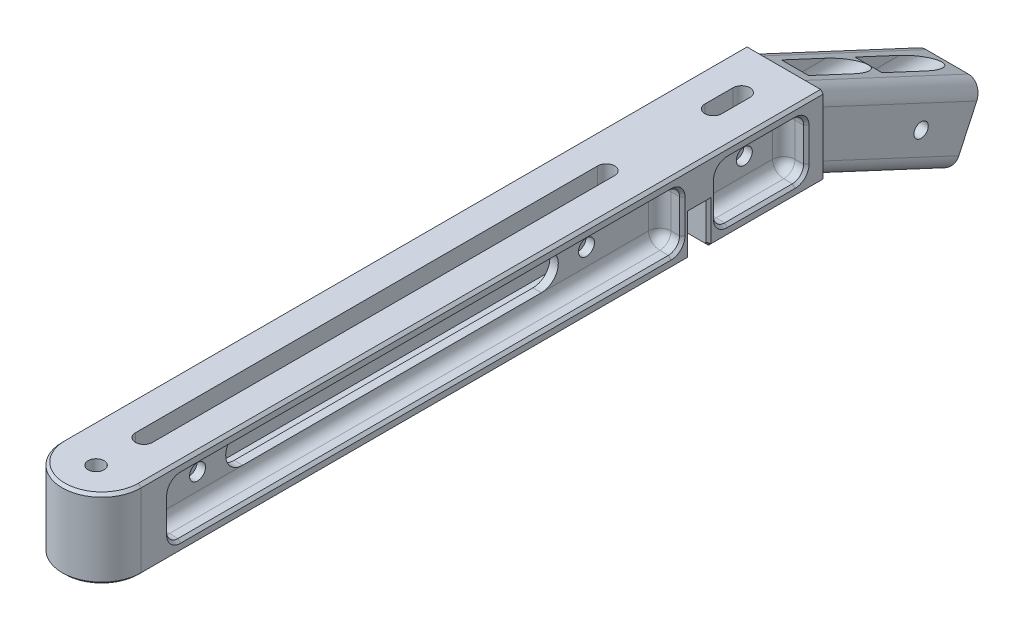
from build123d import *

# Parameters (mm, degrees)
BOSS_EXTRUDE1_DEPTH             = 203.2
CUT_EXTRUDE1_DEPTH              = 9.525
F_8_CLEARANCE_HOLE1_D           = 4.4958
BOSS_EXTRUDE2_START             = -1.0794999999999995
BOSS_EXTRUDE2_DEPTH             = 20.066
FILLET3_RADIUS                  = 11.1125
FILLET3_LENGTH                  = 22.225
CUT_EXTRUDE2_START              = 184.15
SKETCH19_W                      = 6.3500000000000005
SKETCH19_H                      = 15.874999999999996
CUT_EXTRUDE2_DEPTH              = 179.3875
SKETCH23_R                      = 3.968750000000001
BOSS_EXTRUDE5_DEPTH             = 22.225
FILLET4_R                       = 3.175
F_8_32_TAPPED_HOLE1_AT_2_COUNT  = 2
F_8_32_TAPPED_HOLE1_AT_2_PITCH  = 9.644311542843937
SKETCH28_W                      = 4.7625
SKETCH28_H                      = 12.699999999999983
SKETCH28_W_2                    = 4.762500000000001
SKETCH28_H_2                    = 134.9375
CUT_EXTRUDE3_DEPTH              = 19.05
F_8_CLEARANCE_HOLE2_AT_2_COUNT  = 2
F_8_CLEARANCE_HOLE2_AT_2_PITCH  = 44.44999999999999
F_8_CLEARANCE_HOLE2_AT_3_COUNT  = 2
F_8_CLEARANCE_HOLE2_AT_3_PITCH  = 153.9875
FILLET5_R                       = 2.38125
FILLET6_R                       = 2.38125
FILLET7_R                       = 2.38125
FILLET8_R                       = 2.38125
BOSS_EXTRUDE6_DEPTH             = 4.7625
SKETCH34_R                      = 15.081250000000074
CUT_EXTRUDE4_DEPTH              = 2.6035
CUT_EXTRUDE5_DEPTH              = 7.619999999999999
F_10_32_TAPPED_HOLE2_AT_2_COUNT = 2
F_10_32_TAPPED_HOLE2_AT_2_PITCH = 17.907000000000004
FILLET10_START                  = -11.1125
FILLET10_DEPTH                  = 5.0165001
FILLET12_R                      = 4.064
CUT_EXTRUDE8_DEPTH              = 209.63557086842175
CUT_EXTRUDE9_DEPTH              = 230.11389098368053
FILLET14_R                      = 3.175
CHAMFER2_SIZE                   = 0.762
FILLET15_R                      = 1.5875
CUT_EXTRUDE10_DEPTH             = 207.39492188468986
CHAMFER3_SIZE                   = 0.762
CHAMFER4_SIZE                   = 0.762
CUT_EXTRUDE11_DEPTH             = 206.80799007452856


with BuildPart() as part:
    # Sketch1 → Boss-Extrude1 (new body)
    with BuildSketch(Plane.XY):
        Polygon((-11.112499999999997, 11.112499999999997), (11.112500000000002, 11.112499999999997), (11.112500000000004, -11.1125), (-11.112499999999994, -11.1125), align=None)
    extrude(amount=BOSS_EXTRUDE1_DEPTH)

    # Sketch2 → Cut-Extrude1 (cut)
    with BuildSketch(Plane.XZ.offset(11.1125)):
        with BuildLine():
            Line((-0.7937500000000002, 200.02499999999998), (0.7937500000000002, 200.02499999999998))
            ThreePointArc((0.7937500000000002, 200.02499999999998), (3.0388140302672886, 199.09506403026725), (3.96875, 196.84999999999997))
            Line((3.96875, 196.84999999999997), (3.96875, 190.49999999999997))
            ThreePointArc((3.96875, 190.49999999999997), (3.0388140302672966, 188.25493596973268), (0.7937500000000002, 187.32499999999996))
            Line((0.7937500000000002, 187.32499999999996), (-0.7937500000000002, 187.32499999999996))
            ThreePointArc((-0.7937500000000002, 187.32499999999996), (-3.038814030267288, 188.25493596973268), (-3.968749999999999, 190.49999999999997))
            Line((-3.968749999999999, 190.49999999999997), (-3.96875, 196.84999999999997))
            ThreePointArc((-3.96875, 196.84999999999997), (-3.0388140302672966, 199.09506403026725), (-0.7937500000000002, 200.02499999999998))
        make_face()
    extrude(amount=-CUT_EXTRUDE1_DEPTH, mode=Mode.SUBTRACT)

    # #8 Clearance Hole1 (through all)
    with Locations(Plane(origin=(0, -1.5875000000000004, 0), x_dir=(-1, 0, 0), z_dir=(0, -1, 0))):
        with Locations((0, -193.675)):
            Hole(F_8_CLEARANCE_HOLE1_D / 2)

    # Fillet3: full round fillet: the end face becomes a half cylinder, R = half its width
    fillet3_face = Plane((0, 0, 203.2), x_dir=(0, -1, 0), z_dir=(0, 0, 1))  # on the end face: x along it, z out of the body
    fillet3_slab = fillet3_face.offset(-FILLET3_RADIUS / 2) * Box(FILLET3_LENGTH, 2 * FILLET3_RADIUS, FILLET3_RADIUS, mode=Mode.PRIVATE)  # the body's end, R deep
    fillet3_round = Plane((0, 0, 192.08749999999998), x_dir=(0, 0, 1), z_dir=(0, -1, 0)) * Cylinder(FILLET3_RADIUS, FILLET3_LENGTH, mode=Mode.PRIVATE)  # its axis R under the face
    add(fillet3_slab - fillet3_round, mode=Mode.SUBTRACT)

    # Sketch19 → Cut-Extrude2 (cut)
    with BuildSketch(Plane.XY.offset(CUT_EXTRUDE2_START)):
        with Locations((7.9375000000000036, -2.22e-15)):
            Rectangle(SKETCH19_W, SKETCH19_H)
        Polygon((-4.762499999999997, -7.937500000000002), (-11.112499999999997, -7.9375), (-11.112499999999997, 7.9374999999999964), (-4.762499999999997, 7.9374999999999964), align=None)
    extrude(amount=-CUT_EXTRUDE2_DEPTH, mode=Mode.SUBTRACT)

    # Sketch23 → Boss-Extrude5 (add)
    with BuildSketch(Plane.XZ.offset(11.1125)):
        with Locations((0, 34.92499999999998)):
            Circle(SKETCH23_R)
    extrude(amount=-BOSS_EXTRUDE5_DEPTH)

    # Fillet4
    fillet4_edges = [part.edges().sort_by_distance(p)[0] for p in [
        (4.762500000000004, -7.9375, 94.45625000000001),
        (4.762500000000004, 7.9374999999999964, 94.45625000000001),
        (7.9375000000000036, 7.9374999999999964, 184.15),
        (4.762500000000004, -1.78e-15, 184.15),
        (7.9375000000000036, -7.9375, 184.15),
        (7.9375000000000036, -7.9375, 4.762500000000017),
        (4.762500000000004, -1.78e-15, 4.762500000000017),
        (7.9375000000000036, 7.9374999999999964, 4.762500000000017),
        (-4.762499999999997, 7.9374999999999964, 94.45625000000001),
        (-4.762499999999997, -7.937500000000002, 94.45625000000001),
        (-7.9374999999999964, -7.937500000000001, 184.15),
        (-4.762499999999997, -2.66e-15, 184.15),
        (-7.9374999999999964, 7.9374999999999964, 184.15),
        (-7.9374999999999964, 7.9374999999999964, 4.762500000000017),
        (-4.762499999999997, -2.66e-15, 4.762500000000017),
        (-7.9374999999999964, -7.937500000000001, 4.762500000000017),
    ]]
    fillet(fillet4_edges, radius=FILLET4_R)

    # Sketch27 → #8-32 Tapped Hole1 (revolve, cut)
    with BuildSketch(Plane(origin=(0, 3.8084567174445882, 0), x_dir=(0, 1, 0), z_dir=(1, 0, 0))):
        Polygon((0, 0), (-2.12e-15, 8.657806461184402), (1.7271999999999985, 7.62), (1.7271999999999894, -1.34e-15), align=None)
    f_8_32_tapped_hole1 = revolve(axis=Axis((0, 3.8084567174445882, -6.349999999999991), (0, 0, 1)), mode=Mode.SUBTRACT)

    # #8-32 Tapped Hole1 at 2: #8-32 Tapped Hole1 ×2
    with Locations(*[(0, -i * F_8_32_TAPPED_HOLE1_AT_2_PITCH, 0) for i in range(1, F_8_32_TAPPED_HOLE1_AT_2_COUNT)]):
        add(f_8_32_tapped_hole1, mode=Mode.SUBTRACT)

    # Sketch28 → Cut-Extrude3 (cut)
    with BuildSketch(Plane(origin=(0, 11.112499999999997, 0), x_dir=(1, 0, 0), z_dir=(0, 1, 0))):
        with Locations((4.4e-16, -15.874999999999993)):
            Rectangle(SKETCH28_W, SKETCH28_H)
        with Locations((-2.2e-16, -115.09375)):
            Rectangle(SKETCH28_W_2, SKETCH28_H_2)
    extrude(amount=-CUT_EXTRUDE3_DEPTH, mode=Mode.SUBTRACT)

    # Sketch30 → #8 Clearance Hole2 (revolve, cut)
    with BuildSketch(Plane(origin=(-4.762499999999997, -1.73e-15, 15.875), x_dir=(0, 0, 1), z_dir=(0, 1, 0))):
        Polygon((0, 0), (-3.89e-15, 15.875), (2.2478999999999965, 15.875), (2.247899999999998, -4e-17), align=None)
    f_8_clearance_hole2 = revolve(axis=Axis((-11.112499999999986, -1.73e-15, 15.875), (1, 0, 0)), mode=Mode.SUBTRACT)

    # #8 Clearance Hole2 at 2: #8 Clearance Hole2 ×2
    with Locations(*[(0, 0, i * F_8_CLEARANCE_HOLE2_AT_2_PITCH) for i in range(1, F_8_CLEARANCE_HOLE2_AT_2_COUNT)]):
        add(f_8_clearance_hole2, mode=Mode.SUBTRACT)

    # #8 Clearance Hole2 at 3: #8 Clearance Hole2 ×2
    with Locations(*[(0, 0, i * F_8_CLEARANCE_HOLE2_AT_3_PITCH) for i in range(1, F_8_CLEARANCE_HOLE2_AT_3_COUNT)]):
        add(f_8_clearance_hole2, mode=Mode.SUBTRACT)

    # Fillet5
    fillet5_edges = [part.edges().sort_by_distance(p)[0] for p in [
        (2.3812500000000005, 1.5874999999999968, 9.525),
        (-2.3812499999999996, 1.5874999999999968, 9.525),
    ]]
    fillet(fillet5_edges, radius=FILLET5_R - 0.0001)  # a hair under: the kernel refuses the full size

    # Fillet6
    fillet6_edges = [part.edges().sort_by_distance(p)[0] for p in [
        (2.3812500000000005, 1.5874999999999968, 22.224999999999984),
        (-2.3812499999999996, 1.5874999999999968, 22.224999999999984),
    ]]
    fillet(fillet6_edges, radius=FILLET6_R - 0.0001)  # a hair under: the kernel refuses the full size

    # Fillet7
    fillet7_edges = [part.edges().sort_by_distance(p)[0] for p in [
        (2.3812500000000005, 1.5874999999999968, 47.624999999999986),
        (-2.381250000000001, 1.5874999999999968, 47.624999999999986),
    ]]
    fillet(fillet7_edges, radius=FILLET7_R - 0.0001)  # a hair under: the kernel refuses the full size

    # Fillet8
    fillet8_edges = [part.edges().sort_by_distance(p)[0] for p in [
        (2.3812500000000005, 1.5874999999999968, 182.5625),
        (-2.381250000000001, 1.5874999999999968, 182.5625),
    ]]
    fillet(fillet8_edges, radius=FILLET8_R - 0.0001)  # a hair under: the kernel refuses the full size

    # Sketch34<4> → Boss-Extrude6 (add, symmetric)
    with BuildSketch(Plane(origin=(0, 0, 34.925), x_dir=(-1, 0, 0), z_dir=(0, 0, -1))):
        with BuildLine():
            ThreePointArc((4.762499999999996, -4.762500000000001), (5.692435969732708, -7.0075640302672895), (7.9374999999999964, -7.9375))
            Line((7.9374999999999964, -7.9375), (11.112499999999997, -7.9375))
            Line((11.112499999999997, -7.9375), (11.112500000000004, 7.9374999999999964))
            Line((11.112500000000004, 7.9374999999999964), (4.762499999999997, 7.9374999999999964))
            Line((4.762499999999997, 7.9374999999999964), (4.762499999999996, -4.762500000000001))
        make_face()
        with BuildLine():
            Line((-11.112500000000004, -7.9375), (-7.9375000000000036, -7.9375))
            ThreePointArc((-7.9375000000000036, -7.9375), (-5.692435969732716, -7.007564030267288), (-4.762500000000005, -4.7625))
            Line((-4.762500000000004, -4.7625), (-4.762500000000005, 7.937499999999996))
            Line((-4.762500000000005, 7.9374999999999964), (-11.112500000000004, 7.9374999999999964))
            Line((-11.112500000000004, 7.9374999999999964), (-11.112500000000004, -7.9375))
        make_face()
    extrude(amount=BOSS_EXTRUDE6_DEPTH, both=True)

    # Sketch34 → Cut-Extrude4 (cut, symmetric)
    with BuildSketch(Plane(origin=(0, 0, 34.925), x_dir=(-1, 0, 0), z_dir=(0, 0, -1))):
        with Locations((4.086e-14, -9.27100000000006)):
            Circle(SKETCH34_R)
        with BuildLine():
            Line((3.174999999999999, -9.270999999999999), (3.1749999999999994, -11.1125))
            Line((3.1749999999999994, -11.1125), (3.175, -12.953999999999999))
            ThreePointArc((3.1749999999999994, -12.953999999999999), (-1.9e-16, -16.128999999999998), (-3.1749999999999994, -12.953999999999999))
            Line((-3.175, -12.953999999999999), (-3.1750000000000003, -11.1125))
            Line((-3.1750000000000003, -11.1125), (-3.1750000000000007, -9.271))
            ThreePointArc((-3.1750000000000007, -9.271), (-1.54e-15, -6.096), (3.175, -9.270999999999999))
        make_face(mode=Mode.SUBTRACT)
    extrude(amount=CUT_EXTRUDE4_DEPTH, both=True, mode=Mode.SUBTRACT)

    # Sketch34<3> → Cut-Extrude5 (cut, symmetric)
    with BuildSketch(Plane(origin=(0, 0, 34.925), x_dir=(-1, 0, 0), z_dir=(0, 0, -1))):
        with BuildLine():
            Line((-3.175, -12.953999999999999), (-3.1750000000000007, -9.271))
            ThreePointArc((-3.1750000000000007, -9.271), (-5.1e-16, -6.096), (3.174999999999999, -9.270999999999999))
            Line((3.174999999999999, -9.270999999999999), (3.175, -12.953999999999999))
            ThreePointArc((3.175, -12.953999999999999), (9e-17, -16.128999999999998), (-3.175, -12.953999999999999))
        make_face()
    extrude(amount=CUT_EXTRUDE5_DEPTH, both=True, mode=Mode.SUBTRACT)

    # Sketch37 → #10-32 Tapped Hole2 (revolve, cut)
    with BuildSketch(Plane(origin=(0, -11.1125, 43.8785), x_dir=(0, 0, -1), z_dir=(1, 0, 0))):
        Polygon((0, 0), (-3.22e-15, 13.151317848002344), (2.019299999999998, 11.93799999999999), (2.019299999999997, 9.652000000000001), (2.4129999999999945, 9.652000000000001), (2.412999999999995, 0), align=None)
    f_10_32_tapped_hole2 = revolve(axis=Axis((0, -17.46249999999999, 43.8785), (0, 1, 0)), mode=Mode.SUBTRACT)

    # #10-32 Tapped Hole2 at 2: #10-32 Tapped Hole2 ×2
    with Locations(*[(0, 0, -i * F_10_32_TAPPED_HOLE2_AT_2_PITCH) for i in range(1, F_10_32_TAPPED_HOLE2_AT_2_COUNT)]):
        add(f_10_32_tapped_hole2, mode=Mode.SUBTRACT)

    # Fillet10: read off the stored shape, not the designer's step
    # Fillet10 outline → Fillet10 (add)
    with BuildSketch(Plane(origin=(0, 0, 0), x_dir=(1, 0, 0), z_dir=(0, 1, 0)).offset(FILLET10_START)):
        with BuildLine():
            Line((3.175, -27.305), (2.011056128, -27.305))
            ThreePointArc((2.011056128, -27.305), (2.850938088, -27.87376609), (3.175, -28.83495309))
            Line((3.175, -28.83495309), (3.175, -27.305))
        make_face()
        with BuildLine():
            Line((3.175, -42.545), (3.175, -41.01504691))
            ThreePointArc((3.175, -41.01504691), (2.850938088, -41.97623391), (2.011056128, -42.545))
            Line((2.011056128, -42.545), (3.175, -42.545))
        make_face()
        with BuildLine():
            Line((-3.175, -27.305), (-3.175, -28.83495309))
            ThreePointArc((-3.175, -28.83495309), (-2.850938088, -27.87376609), (-2.011056128, -27.305))
            Line((-2.011056128, -27.305), (-3.175, -27.305))
        make_face()
        with BuildLine():
            Line((-3.175, -42.545), (-2.011056128, -42.545))
            ThreePointArc((-2.011056128, -42.545), (-2.850938088, -41.97623391), (-3.175, -41.01504691))
            Line((-3.175, -41.01504691), (-3.175, -42.545))
        make_face()
    extrude(amount=FILLET10_DEPTH)

    # Fillet14
    fillet14_edges = [part.edges().sort_by_distance(p)[0] for p in [
        (4.762500000000004, -8.9e-16, 30.162499999999998),
        (5.692435969732717, -7.007564030267288, 30.162499999999998),
        (9.525000000000004, 7.9374999999999964, 39.6875),
        (5.692435969732713, 7.007564030267285, 39.6875),
        (4.762500000000004, -8.9e-16, 39.6875),
        (9.525000000000004, -7.9375, 39.6875),
        (9.525000000000004, -7.9375, 30.162499999999998),
        (5.692435969732717, -7.007564030267288, 39.6875),
        (9.525000000000004, 7.9374999999999964, 30.162499999999998),
        (5.692435969732713, 7.007564030267285, 30.162499999999994),
        (-5.692435969732708, 7.007564030267286, 39.6875),
        (-5.692435969732708, 7.007564030267286, 30.162499999999994),
        (-5.692435969732708, -7.0075640302672895, 30.162499999999998),
        (-9.525, 7.9374999999999964, 30.162499999999998),
        (-4.762499999999996, -1.78e-15, 39.6875),
        (-9.524999999999997, -7.9375, 39.6875),
        (-4.762499999999996, -1.78e-15, 30.162499999999998),
        (-5.692435969732708, -7.0075640302672895, 39.6875),
        (-9.524999999999997, -7.9375, 30.162499999999998),
        (-9.525, 7.9374999999999964, 39.6875),
    ]]
    fillet(fillet14_edges, radius=FILLET14_R)

    # Chamfer2
    chamfer2_edges = [part.edges().sort_by_distance(p)[0] for p in [
        (-11.112499999999995, 7.007564030267288, 5.69243596973273),
        (-11.112499999999994, -7.007564030267291, 5.692435969732729),
        (-11.112499999999995, 7.007564030267286, 183.22006403026728),
        (-11.112499999999994, -7.007564030267289, 183.22006403026728),
        (11.112500000000002, 7.007564030267288, 5.692435969732729),
        (11.112500000000002, -7.007564030267291, 5.69243596973273),
        (11.112500000000002, 7.007564030267286, 183.22006403026728),
        (11.112500000000002, -7.0075640302672895, 183.22006403026728),
        (11.112500000000004, -1.78e-15, 39.6875),
        (11.112500000000004, 7.9374999999999964, 111.91874999999999),
        (11.112500000000004, -7.9375, 111.91874999999999),
        (11.112500000000004, -1.78e-15, 30.162499999999998),
        (-11.1125, -2.66e-15, 30.162499999999998),
        (-11.1125, -2.66e-15, 39.6875),
        (-11.112499999999997, -7.9375, 111.91874999999999),
        (-11.112499999999997, 7.9374999999999964, 111.91874999999999),
        (11.112500000000002, 7.007564030267283, 40.6174359697327),
        (11.112500000000002, -7.007564030267287, 40.6174359697327),
        (11.112500000000002, 7.007564030267288, 29.232564030267284),
        (11.112500000000002, -7.007564030267291, 29.232564030267284),
        (-11.112499999999994, -7.007564030267291, 29.232564030267284),
        (-11.112499999999995, 7.007564030267288, 29.232564030267284),
        (-11.112499999999994, -7.007564030267288, 40.6174359697327),
        (-11.112499999999995, 7.007564030267283, 40.6174359697327),
        (-11.112499999999997, 7.9374999999999964, 17.462500000000006),
        (-11.112499999999997, -1.78e-15, 184.15),
        (-11.112499999999997, -7.9375, 17.462500000000006),
        (-11.112499999999997, -1.78e-15, 4.762500000000017),
        (11.112500000000004, -7.9375, 17.462500000000006),
        (11.112500000000004, -1.78e-15, 184.15),
        (11.112500000000004, 7.9374999999999964, 17.462500000000006),
        (11.112500000000004, -1.78e-15, 4.762500000000017),
    ]]
    chamfer(chamfer2_edges, length=CHAMFER2_SIZE)

    # Fillet15
    fillet15_edges = [part.edges().sort_by_distance(p)[0] for p in [
        (2.519e-14, 5.810250000000014, 37.528499999999994),
        (2.519e-14, 5.810250000000014, 32.3215),
    ]]
    fillet(fillet15_edges, radius=FILLET15_R)

    # Sketch42 → Cut-Extrude10 (cut, through all)
    with BuildSketch(Plane(origin=(11.112500000000002, 8.7e-16, 0), x_dir=(0, 0, -1), z_dir=(1, 8e-17, 0))):
        Polygon((-32.32149999999999, -11.1125), (-37.528499999999994, -11.1125), (-37.528499999999994, 0.9249033593154432), (-32.32149999999999, 0.9249033593154441), align=None)
    extrude(amount=-CUT_EXTRUDE10_DEPTH, mode=Mode.SUBTRACT)

    # Chamfer3
    chamfer3_edges = [part.edges().sort_by_distance(p)[0] for p in [
        (11.112500000000004, -11.1125, 16.16075),
        (-11.112499999999994, -11.1125, 16.16075),
        (-11.112499999999994, -11.1125, 114.80799999999998),
        (-11.112499999999997, 11.112499999999997, 96.04374999999999),
        (11.112500000000002, 11.112499999999997, 96.04374999999999),
        (11.112500000000004, -11.1125, 114.80799999999998),
        (-6.8e-16, -11.1125, 203.2),
        (-6.8e-16, 11.1125, 203.2),
    ]]
    chamfer(chamfer3_edges, length=CHAMFER3_SIZE)

    # Chamfer4
    chamfer4_edges = [part.edges().sort_by_distance(p)[0] for p in [
        (-6.762749999999995, -11.1125, 32.3215),
        (-6.762749999999995, -11.1125, 37.528499999999994),
        (11.112500000000002, -4.712798320342278, 37.528499999999994),
        (11.112500000000002, -4.712798320342277, 32.32149999999999),
        (6.762750000000002, -11.1125, 32.3215),
        (-11.112499999999995, -4.712798320342278, 32.32149999999999),
        (-10.731499999999992, -10.731499999999999, 32.321499999999986),
        (10.731500000000002, -10.7315, 32.321499999999986),
        (-11.112499999999995, -4.712798320342278, 37.528499999999994),
        (6.762750000000002, -11.1125, 37.528499999999994),
        (-10.731499999999992, -10.731499999999997, 37.528499999999994),
        (10.731500000000004, -10.7315, 37.528500000000015),
    ]]
    chamfer(chamfer4_edges, length=CHAMFER4_SIZE)

    # Sketch43 → Cut-Extrude11 (cut, through all)
    with BuildSketch(Plane(origin=(4.762500000000004, 0, 0), x_dir=(0, 0, -1), z_dir=(1, 0, 0))):
        with BuildLine():
            Line((-157.16250000000002, 4.762500000000004), (-73.02499999999999, 4.762500000000004))
            ThreePointArc((-73.02499999999999, 4.762500000000004), (-68.26249999999999, 0), (-73.02499999999999, -4.762500000000004))
            Line((-73.02499999999999, -4.762500000000004), (-157.16250000000002, -4.762500000000004))
            ThreePointArc((-157.16250000000002, -4.762500000000004), (-161.92500000000004, 5.8e-16), (-157.16250000000002, 4.762500000000004))
        make_face()
    extrude(amount=-CUT_EXTRUDE11_DEPTH, mode=Mode.SUBTRACT)


with BuildPart() as body_2:
    # Sketch6 → Boss-Extrude2 (new body)
    with BuildSketch(Plane(origin=(11.112500000000002, 8.7e-16, 0), x_dir=(0, 0, -1), z_dir=(1, 8e-17, 0)).offset(BOSS_EXTRUDE2_START)):
        Polygon((2.76e-15, -11.027881321901361), (37.560177541372916, -28.54247975110498), (46.04043558146181, -10.356507696427565), (0, 11.112499999999995), align=None)
    extrude(amount=-BOSS_EXTRUDE2_DEPTH)

    # Sketch25 → Cut-Revolve1 (revolve, cut)
    with BuildSketch(Plane(origin=(0, 0, 0), x_dir=(0, 0, -1), z_dir=(1, 0, 0))):
        Polygon((23.8341427342828, 3.8084567174445914), (7.492999999999999, 3.808456717444589), (2.7e-16, 3.808456717444591), (0, 5.967456717444588), (3.174999999999997, 5.967456717444588), (3.174999999999997, 7.618456717444587), (7.4929999999999986, 7.618456717444592), (23.8341427342828, 7.618456717444592), align=None)
    revolve(axis=Axis((0, 3.8084567174445914, -23.8341427342828), (0, -1.6e-16, 1)), mode=Mode.SUBTRACT)

    # Sketch25<4> → Cut-Revolve2 (revolve, cut)
    with BuildSketch(Plane(origin=(0, 0, 0), x_dir=(0, 0, -1), z_dir=(1, 0, 0))):
        Polygon((44.516435581461806, -5.835854825399353), (28.175292847179012, -5.835854825399349), (0, -5.8358548253993545), (-6e-17, -3.2831548253993557), (23.857292847179014, -3.2831548253993525), (23.857292847179014, -2.0258548253993536), (28.175292847179012, -2.0258548253993536), (44.516435581461806, -2.025854825399353), align=None)
    revolve(axis=Axis((0, -5.835854825399353, -44.516435581461806), (0, 2.1e-16, 1)), mode=Mode.SUBTRACT)

    # Sketch33 → #10-32 Tapped Hole1 (revolve, cut)
    with BuildSketch(Plane(origin=(-10.032999999999996, -13.287234065964906, -28.645399599497523), x_dir=(-5e-17, 0, 1), z_dir=(0, 1, 0))):
        Polygon((0, 0), (-5.18e-15, 21.145500000000013), (2.0192999999999945, 21.145500000000013), (2.019299999999998, 1.7e-16), align=None)
    revolve(axis=Axis((-16.38299999999999, -13.287234065964906, -28.645399599497523), (1, 0, 3e-17)), mode=Mode.SUBTRACT)

    # Fillet12
    fillet12_edges = [body_2.edges().sort_by_distance(p)[0] for p in [
        (-10.032999999999996, 0.3779961517862144, -23.020217790730904),
        (10.033000000000003, 0.37799615178621593, -23.020217790730904),
        (10.033000000000005, -19.78518053650317, -18.78008877068646),
        (-10.032999999999994, -19.78518053650317, -18.78008877068646),
    ]]
    fillet(fillet12_edges, radius=FILLET12_R)

    # Sketch40 → Cut-Extrude8 (cut, through all)
    with BuildSketch(Plane(origin=(0, 5.1e-16, -3.174999999999998), x_dir=(-1, 0, 0), z_dir=(0, 1.6e-16, -1))):
        with BuildLine():
            Line((-3.8099999999999996, 3.808456717444588), (-3.8099999999999996, 11.133845200344217))
            ThreePointArc((-3.8099999999999996, 11.133845200344217), (2.3e-16, 14.943845200344217), (3.8099999999999996, 11.133845200344217))
            Line((3.8099999999999996, 11.133845200344217), (3.8099999999999996, 3.808456717444588))
            ThreePointArc((3.8099999999999996, 3.808456717444588), (2.3e-16, -0.00154328255540959), (-3.8099999999999996, 3.808456717444588))
        make_face()
    extrude(amount=CUT_EXTRUDE8_DEPTH, mode=Mode.SUBTRACT)

    # Sketch41 → Cut-Extrude9 (cut, through all)
    with BuildSketch(Plane(origin=(0, -5.07e-15, -23.857292847179014), x_dir=(-1, 0, 0), z_dir=(0, -2.1e-16, -1))):
        with BuildLine():
            Line((-3.8099999999999947, -5.835854825399343), (-3.8099999999999947, 2.801929126487579))
            ThreePointArc((-3.8099999999999947, 2.801929126487579), (2.3e-16, 6.611929126487574), (3.8099999999999947, 2.801929126487579))
            Line((3.8099999999999947, 2.801929126487579), (3.8099999999999947, -5.835854825399343))
            ThreePointArc((3.8099999999999947, -5.835854825399343), (-7e-16, -9.645854825399342), (-3.8099999999999947, -5.835854825399343))
        make_face()
    extrude(amount=CUT_EXTRUDE9_DEPTH, mode=Mode.SUBTRACT)


solid = Compound([part.part, body_2.part])
